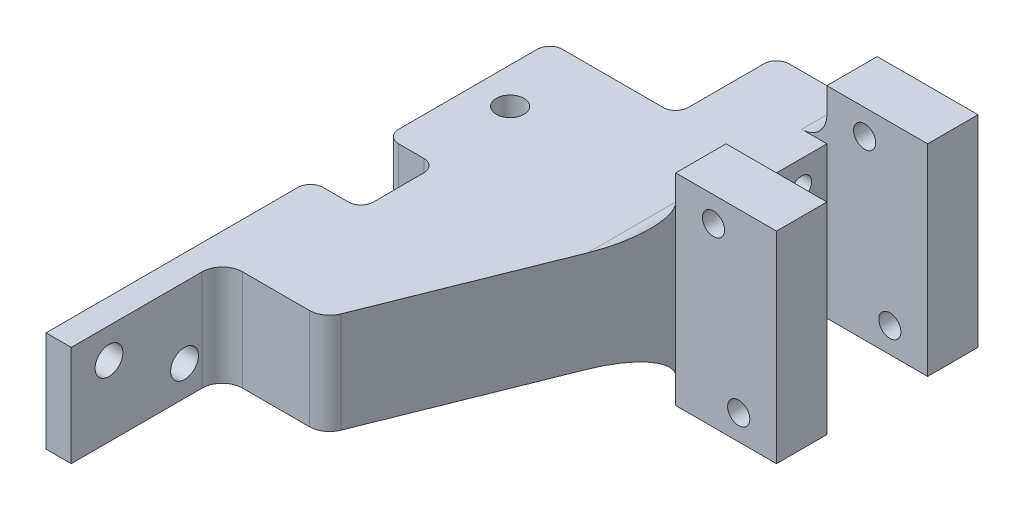
from build123d import *

# Parameters (mm, degrees)
BOSS_EXTRUDE1_DEPTH      = 12.7
BOSS_EXTRUDE2_DEPTH      = 19.05
BOSS_EXTRUDE2_DEPTH_BACK = 6.35
SKETCH3_3_W              = 12.7
SKETCH3_3_H              = 6.35
FILLET1_R                = 3.175
SKETCH4_R                = 1.397
CUT_EXTRUDE1_DEPTH       = 43.18
SKETCH5_R                = 1.25
CUT_EXTRUDE3_DEPTH       = 11.43
SKETCH13_R               = 1.75
CUT_EXTRUDE4_DEPTH       = 19.558
SKETCH14_R               = 1.25
CUT_EXTRUDE5_DEPTH       = 12.7
SKETCH20_R               = 1.75
CUT_EXTRUDE6_DEPTH       = 22.098
FILLET2_R                = 1.5875
FILLET3_R                = 1.5875


with BuildPart() as part:
    # Sketch3 → Boss-Extrude1 (new body)
    with BuildSketch(Plane(origin=(0, 0, 0), x_dir=(-1, 0, 0), z_dir=(0, 1, 0))):
        with BuildLine():
            Line((0, 30.1625), (0, 63.5))
            Line((0, 63.5), (-3.175, 63.5))
            Line((-3.175, 63.5), (-3.175, 46.99))
            ThreePointArc((-3.175, 46.99), (-3.918948776, 45.193948776), (-5.715, 44.45))
            Line((-5.715, 44.45), (-14.155336278, 44.45))
            ThreePointArc((-14.155336278, 44.45), (-15.579333454, 44.013290765), (-16.513667073, 42.853332318))
            Line((-16.513667073, 42.853332318), (-28.575, 12.7))
            Line((-28.575, 12.7), (-28.575, -12.7))
            Line((-28.575, -12.7), (-17.4625, -12.7))
            ThreePointArc((-17.4625, -12.7), (-16.339967985, -12.235032015), (-15.875, -11.1125))
            Line((-15.875, -11.1125), (-15.875, -1.5875))
            ThreePointArc((-15.875, -1.5875), (-15.410032015, -0.464967985), (-14.2875, 0))
            Line((-14.2875, 0), (0, 0))
            Line((0, 0), (0, 20.6375))
            Line((0, 20.6375), (-6.35, 20.6375))
            Line((-6.35, 20.6375), (-6.35, 30.1625))
            Line((-6.35, 30.1625), (0, 30.1625))
        make_face()
    extrude(amount=BOSS_EXTRUDE1_DEPTH)

    # Sketch3<3> → Boss-Extrude2 (add, two sides: drawn at the far end of the back side and taken through both)
    with BuildSketch(Plane(origin=(0, 0, 0), x_dir=(-1, 0, 0), z_dir=(0, 1, 0)).offset(-BOSS_EXTRUDE2_DEPTH_BACK)):
        with Locations((-34.925, 9.525)):
            Rectangle(SKETCH3_3_W, SKETCH3_3_H)
        with Locations((-34.925, -9.525)):
            Rectangle(SKETCH3_3_W, SKETCH3_3_H)
    extrude(amount=BOSS_EXTRUDE2_DEPTH + BOSS_EXTRUDE2_DEPTH_BACK)

    # Fillet1
    fillet1_edges = [part.edges().sort_by_distance(p)[0] for p in [
        (28.575, 12.7, 9.525),
        (28.575, 12.7, -9.525),
        (28.575, 0, -9.525),
        (28.575, 0, 9.525),
    ]]
    fillet(fillet1_edges, radius=FILLET1_R)

    # Sketch4 → Cut-Extrude1 (cut)
    with BuildSketch(Plane.XY.offset(12.7)):
        with Locations((33.3375, 15.875)):
            Circle(SKETCH4_R)
        with Locations((36.5125, -3.175)):
            Circle(SKETCH4_R)
    extrude(amount=-CUT_EXTRUDE1_DEPTH, mode=Mode.SUBTRACT)

    # Sketch5 → Cut-Extrude3 (cut)
    with BuildSketch(Plane.YZ.offset(28.575)):
        with Locations((3.175, 3.175)):
            Circle(SKETCH5_R)
        with Locations((9.525, -3.175)):
            Circle(SKETCH5_R)
    extrude(amount=-CUT_EXTRUDE3_DEPTH, mode=Mode.SUBTRACT)

    # Sketch13 → Cut-Extrude4 (cut)
    with BuildSketch(Plane(origin=(0, 12.7, 0), x_dir=(-1, 0, 0), z_dir=(0, 1, 0))):
        with Locations((-4.525, 9.525)):
            Circle(SKETCH13_R)
    extrude(amount=-CUT_EXTRUDE4_DEPTH, mode=Mode.SUBTRACT)

    # Sketch14 → Cut-Extrude5 (cut)
    with BuildSketch(Plane(origin=(0, 0, 0), x_dir=(0, -1, 0), z_dir=(-1, 0, 0))):
        with Locations((-8.89, 14.2875)):
            Circle(SKETCH14_R)
        with Locations((-3.81, 4.7625)):
            Circle(SKETCH14_R)
    extrude(amount=-CUT_EXTRUDE5_DEPTH, mode=Mode.SUBTRACT)

    # Sketch20 → Cut-Extrude6 (cut)
    with BuildSketch(Plane.YZ.offset(3.175)):
        with Locations((8.89, 58.7375)):
            Circle(SKETCH20_R)
        with Locations((3.81, 49.2125)):
            Circle(SKETCH20_R)
    extrude(amount=-CUT_EXTRUDE6_DEPTH, mode=Mode.SUBTRACT)

    # Fillet2
    fillet2_edges = [part.edges().sort_by_distance(p)[0] for p in [
        (0, 6.35, 30.1625),
        (6.35, 6.35, 30.1625),
        (6.35, 6.35, 20.6375),
        (0, 6.35, 20.6375),
    ]]
    fillet(fillet2_edges, radius=FILLET2_R)

    # Fillet3
    fillet3_edges = [part.edges().sort_by_distance(p)[0] for p in [
        (0, 6.35, 0),
    ]]
    fillet(fillet3_edges, radius=FILLET3_R)


solid = part.part
